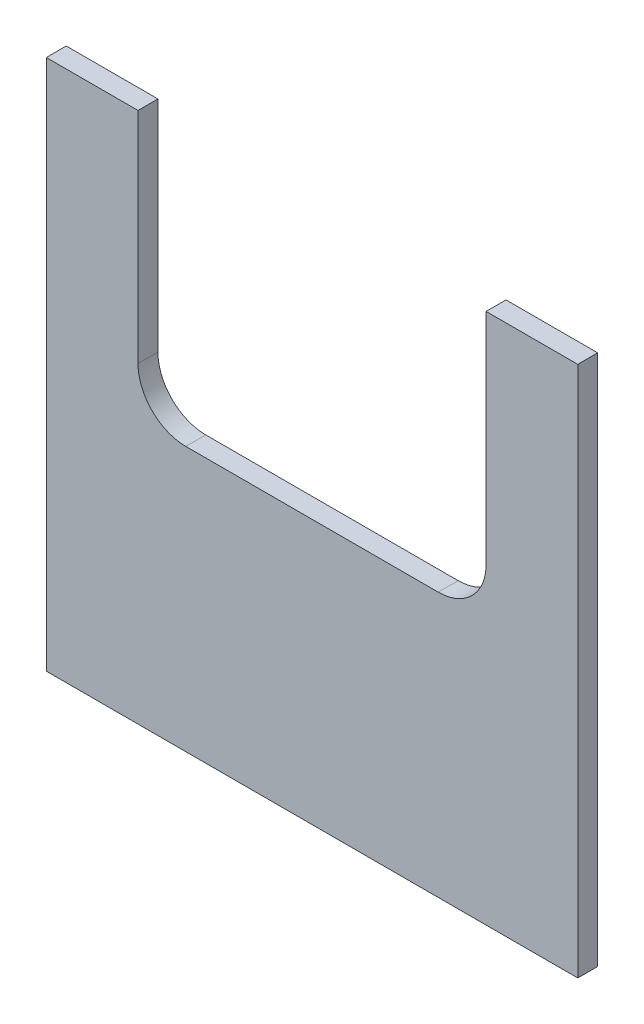
from build123d import *

# Parameters (mm, degrees)
TABAN_FLAN_1_DEPTH = 15


# Sheet-metal steps are written as plain solids
with BuildPart() as part:
    # Çizim1 → Taban-Flanş1 (new body)
    with BuildSketch(Plane.XY):
        with BuildLine():
            Line((-234.910345825, 161.344850299), (-234.910345825, -238.655149701))
            Line((-234.910345825, -238.655149701), (165.089654175, -238.655149701))
            Line((165.089654175, -238.655149701), (165.089654175, 161.344850299))
            Line((165.089654175, 161.344850299), (96.089654175, 161.344850299))
            Line((96.089654175, 161.344850299), (96.089654175, -3.655149701))
            ThreePointArc((96.089654175, -3.655149701), (85.545498298, -29.110993823), (60.089654175, -39.655149701))
            Line((60.089654175, -39.655149701), (-129.910345825, -39.655149701))
            ThreePointArc((-129.910345825, -39.655149701), (-155.366189948, -29.110993823), (-165.910345825, -3.655149701))
            Line((-165.910345825, -3.655149701), (-165.910345825, 161.344850299))
            Line((-165.910345825, 161.344850299), (-234.910345825, 161.344850299))
        make_face()
    extrude(amount=-TABAN_FLAN_1_DEPTH)


solid = part.part
